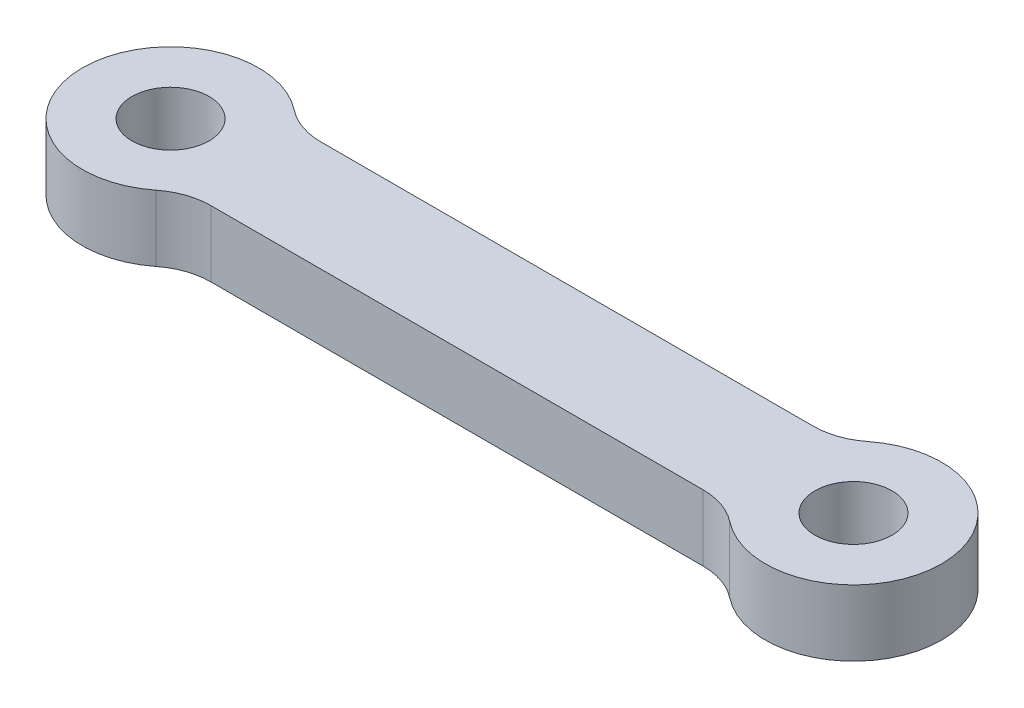
from build123d import *

# Parameters (mm, degrees)
SKETCH1_R           = 1.75
BOSS_EXTRUDE1_DEPTH = 3
FILLET1_R           = 3


with BuildPart() as part:
    # Sketch1 → Boss-Extrude1 (new body)
    with BuildSketch(Plane(origin=(0, 0, 0), x_dir=(1, 0, 0), z_dir=(0, 1, 0))):
        with BuildLine():
            ThreePointArc((3.122498999, 2.5), (-4, 0), (3.122498999, -2.5))
            Line((3.122498999, -2.5), (27.877501001, -2.5))
            ThreePointArc((27.877501001, -2.5), (35, 0), (27.877501001, 2.5))
            Line((27.877501001, 2.5), (3.122498999, 2.5))
        make_face()
        Circle(SKETCH1_R, mode=Mode.SUBTRACT)
        with Locations((31, 0)):
            Circle(SKETCH1_R, mode=Mode.SUBTRACT)
    extrude(amount=BOSS_EXTRUDE1_DEPTH)

    # Fillet1
    fillet1_edges = [part.edges().sort_by_distance(p)[0] for p in [
        (3.122498999, 1.5, 2.5),
        (27.877501001, 1.5, 2.5),
        (27.877501001, 1.5, -2.5),
        (3.122498999, 1.5, -2.5),
    ]]
    fillet(fillet1_edges, radius=FILLET1_R)


solid = part.part
